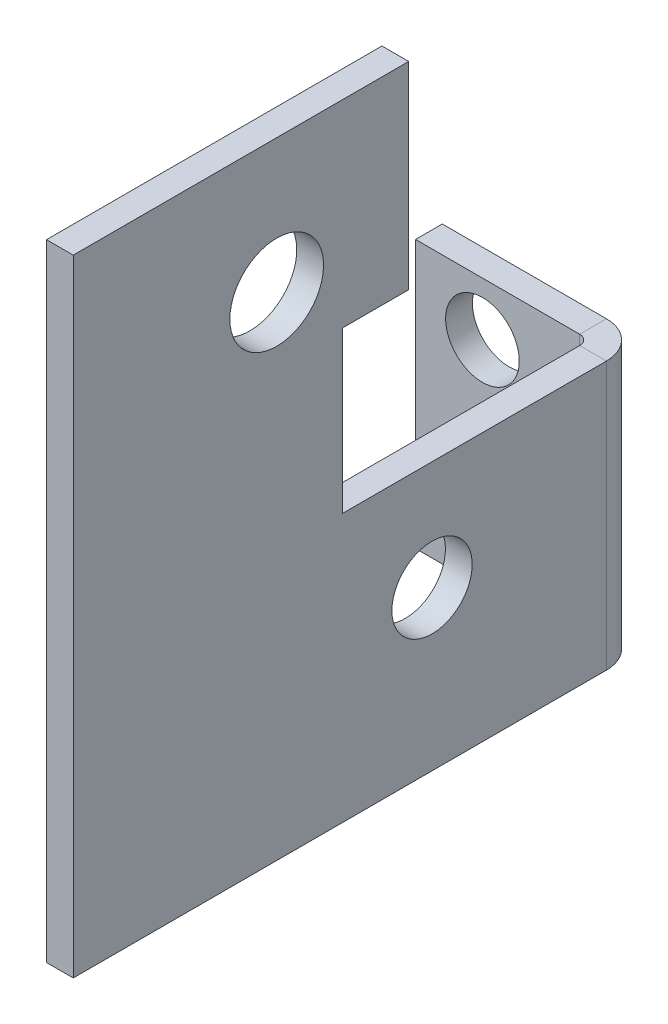
from build123d import *

# Parameters (mm, degrees)
SKETCH_1_W                       = 2
SKETCH_1_H                       = 50
SM_BASE_FLANGE_1_DEPTH           = 35.2
SKETCH_7_W                       = 16.759406963
SKETCH_7_H                       = 59.520719971
CUT_EXTRUDE_2_DEPTH              = 4.8
SKETCH_9_W                       = 8.068883198
SKETCH_9_H                       = 35.697926428
CUT_EXTRUDE_3_DEPTH              = 3.23
SKETCH_6_R                       = 3.5
CUT_EXTRUDE_5_DEPTH              = 10
SKETCH_15_W                      = 15.322876818
SKETCH_15_H                      = 12
CUT_EXTRUDE_7_DEPTH              = 10
SKETCH_18_R                      = 3
CUT_EXTRUDE_8_DEPTH              = 10
SKETCH_19_W                      = 2
SKETCH_19_H                      = 14.77
SKETCH_19_H_2                    = 20
EXTRUDE_1_DEPTH                  = 2.66
SKETCH_20_W                      = 8
SKETCH_20_H                      = 14.77
CUT_EXTRUDE_9_DEPTH              = 8
SKETCH_21_W                      = 2
SKETCH_21_H                      = 20
EXTRUDE_2_DEPTH                  = 9.51
SM_EDGE_FLANGE_1_STRIP_W         = 9.4732
SM_EDGE_FLANGE_1_STRIP_H         = 2
SM_EDGE_FLANGE_1_STRIP_CUT_DEPTH = 20
SM_EDGE_FLANGE_1_DEPTH           = 20
SKETCH_27_R                      = 2.75
CUT_EXTRUDE_10_DEPTH             = 9.51


# Sheet-metal steps are written as plain solids
with BuildPart() as part:
    # Sketch 1 → 基体-法兰1 (new body)
    with BuildSketch(Plane.XY):
        with Locations((1, 25)):
            Rectangle(SKETCH_1_W, SKETCH_1_H)
    extrude(amount=SM_BASE_FLANGE_1_DEPTH)

    # 草图7 → 切除-拉伸2 (cut)
    with BuildSketch(Plane(origin=(0, 0, 0), x_dir=(-1, 0, 0), z_dir=(0, 0, -1))):
        with Locations((6.379703482, 29.760359986)):
            Rectangle(SKETCH_7_W, SKETCH_7_H)
    extrude(amount=-CUT_EXTRUDE_2_DEPTH, mode=Mode.SUBTRACT)

    # 草图9 → 切除-拉伸3 (cut)
    with BuildSketch(Plane.XZ):
        with Locations((4.034441599, 17.351036786)):
            Rectangle(SKETCH_9_W, SKETCH_9_H)
    extrude(amount=-CUT_EXTRUDE_3_DEPTH, mode=Mode.SUBTRACT)

    # 草图6 → 切除-拉伸5 (cut)
    with BuildSketch(Plane.ZY):
        with Locations((20, 40)):
            Circle(SKETCH_6_R)
    extrude(amount=-CUT_EXTRUDE_5_DEPTH, mode=Mode.SUBTRACT)

    # 草图15 → 切除-拉伸7 (cut)
    with BuildSketch(Plane.ZY):
        with Locations((7.438561591, 29.23)):
            Rectangle(SKETCH_15_W, SKETCH_15_H)
    extrude(amount=-CUT_EXTRUDE_7_DEPTH, mode=Mode.SUBTRACT)

    # 草图18 → 切除-拉伸8 (cut)
    with BuildSketch(Plane.ZY):
        with Locations((8.3960026, 15.09020987)):
            Circle(SKETCH_18_R)
    extrude(amount=-CUT_EXTRUDE_8_DEPTH, mode=Mode.SUBTRACT)

    # 草图19 → 凸台-拉伸1 (add)
    with BuildSketch(Plane(origin=(0, 0, 4.8), x_dir=(-1, 0, 0), z_dir=(0, 0, -1))):
        with Locations((-1, 42.615)):
            Rectangle(SKETCH_19_W, SKETCH_19_H)
        with Locations((-1, 13.23)):
            Rectangle(SKETCH_19_W, SKETCH_19_H_2)
    extrude(amount=EXTRUDE_1_DEPTH)

    # 草图20 → 切除-拉伸9 (cut)
    with BuildSketch(Plane.ZY):
        with Locations((6.14, 42.615)):
            Rectangle(SKETCH_20_W, SKETCH_20_H)
    extrude(amount=-CUT_EXTRUDE_9_DEPTH, mode=Mode.SUBTRACT)

    # 草图21 → 凸台-拉伸2 (add)
    with BuildSketch(Plane(origin=(0, 0, 2.14), x_dir=(-1, 0, 0), z_dir=(0, 0, -1))):
        with Locations((-1, 13.23)):
            Rectangle(SKETCH_21_W, SKETCH_21_H)
    extrude(amount=EXTRUDE_2_DEPTH)

    # 边线-法兰1 strip (across the edge) → 边线-法兰1 strip cut (cut)
    with BuildSketch(Plane(origin=(0, 23.23, -7.37), x_dir=(0, 0, 1), z_dir=(0, -1, 0))):
        with Locations((-2, -1)):
            Rectangle(SM_EDGE_FLANGE_1_STRIP_W, SM_EDGE_FLANGE_1_STRIP_H)
    extrude(amount=SM_EDGE_FLANGE_1_STRIP_CUT_DEPTH, mode=Mode.SUBTRACT)

    # 边线-法兰1 section (across the edge) → 边线-法兰1 (add)
    with BuildSketch(Plane(origin=(0, 23.23, -7.37), x_dir=(0, 0, 1), z_dir=(0, -1, 0))):
        with BuildLine():
            Line((0, 0.7366), (0, 13))
            Line((0, 13), (2, 13))
            Line((2, 13), (2, 0.7366))
            ThreePointArc((2, 0.7366), (2.215745145, 0.215745145), (2.7366, 0))
            Line((2.7366, 0), (2.7366, -2))
            ThreePointArc((2.7366, -2), (0.801531583, -1.198468417), (0, 0.7366))
        make_face()
    extrude(amount=SM_EDGE_FLANGE_1_DEPTH)

    # 草图27 → 切除-拉伸10 (cut)
    with BuildSketch(Plane.XY.offset(-5.37)):
        with Locations((-8, 19.23)):
            Circle(SKETCH_27_R)
        with Locations((-8, 7.23)):
            Circle(SKETCH_27_R)
    extrude(amount=-CUT_EXTRUDE_10_DEPTH, mode=Mode.SUBTRACT)


solid = part.part
